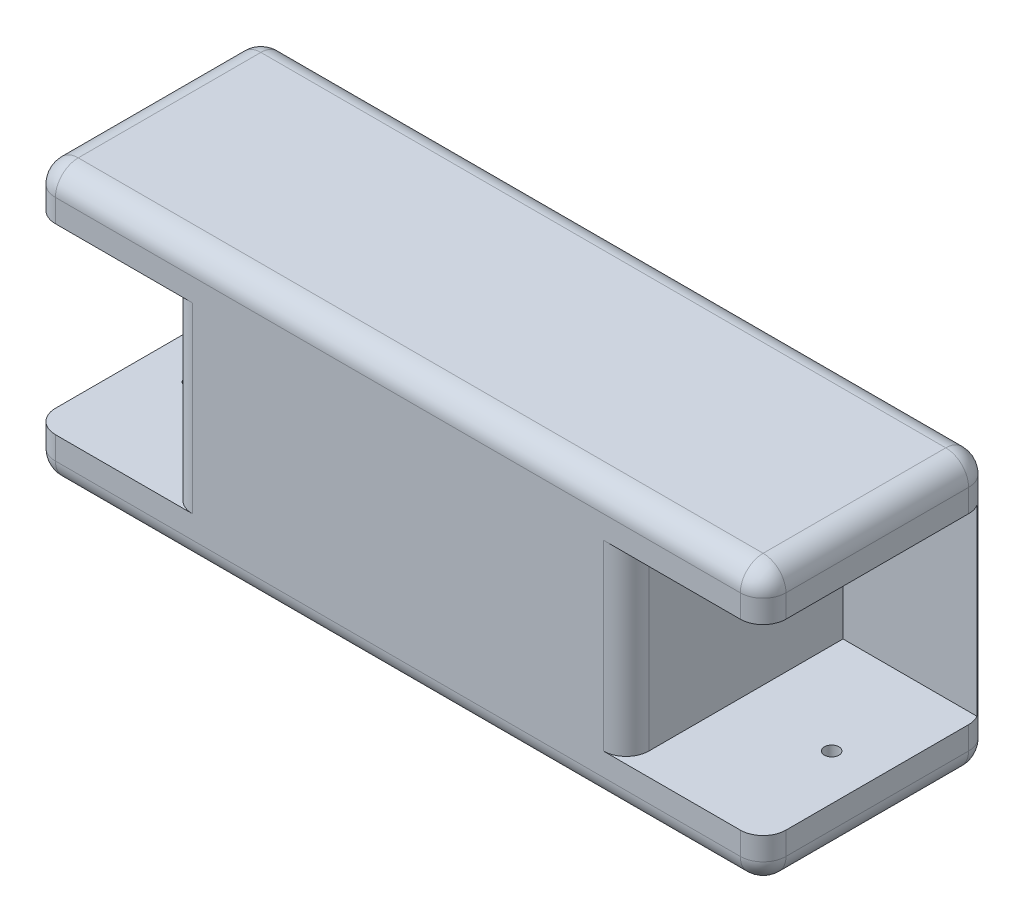
from build123d import *

# Parameters (mm, degrees)
SKETCH2_W           = 160
SKETCH2_H           = 60
BOSS_EXTRUDE1_DEPTH = 50
SKETCH4_W           = 30
SKETCH4_H           = 40
CUT_EXTRUDE1_DEPTH  = 99.994949366
SKETCH5_R           = 1.6
CUT_EXTRUDE2_DEPTH  = 3.2
CUT_EXTRUDE3_START  = -3.2
SKETCH6_R           = 1.6
CUT_EXTRUDE3_DEPTH  = 3.2
CUT_EXTRUDE5_START  = -6.8
SKETCH7_R           = 1.6
CUT_EXTRUDE5_DEPTH  = 3.2
CUT_EXTRUDE6_START  = -10
SKETCH8_R           = 1.6
CUT_EXTRUDE6_DEPTH  = 3.2
SKETCH9_W           = 2.5
SKETCH9_H           = 40
BOSS_EXTRUDE2_DEPTH = 30
SKETCH10_W          = 2.5
SKETCH10_H          = 40
BOSS_EXTRUDE3_DEPTH = 30
FILLET1_R           = 5


with BuildPart() as part:
    # Sketch2 → Boss-Extrude1 (new body)
    with BuildSketch(Plane.XY):
        Rectangle(SKETCH2_W, SKETCH2_H)
    extrude(amount=BOSS_EXTRUDE1_DEPTH)

    # Sketch4 → Cut-Extrude1 (cut, through all)
    with BuildSketch(Plane.XY.offset(50)):
        with Locations((65, 0)):
            Rectangle(SKETCH4_W, SKETCH4_H)
        with Locations((-65, 0)):
            Rectangle(SKETCH4_W, SKETCH4_H)
    extrude(amount=-CUT_EXTRUDE1_DEPTH, mode=Mode.SUBTRACT)

    # Sketch5 → Cut-Extrude2 (cut)
    with BuildSketch(Plane(origin=(0, 20, 0), x_dir=(-1, 0, 0), z_dir=(0, -1, 0))):
        with Locations(Location((70, -25, 0), (0, 0, 90))):
            Circle(SKETCH5_R)
    extrude(amount=-CUT_EXTRUDE2_DEPTH, mode=Mode.SUBTRACT)

    # Sketch6 → Cut-Extrude3 (cut)
    with BuildSketch(Plane(origin=(0, -20, 0), x_dir=(1, 0, 0), z_dir=(0, 1, 0)).offset(CUT_EXTRUDE3_START)):
        with Locations(Location((-70, -25, 0), (0, 0, 90))):
            Circle(SKETCH6_R)
    extrude(amount=CUT_EXTRUDE3_DEPTH, mode=Mode.SUBTRACT)

    # Sketch7 → Cut-Extrude5 (cut)
    with BuildSketch(Plane(origin=(0, 30, 0), x_dir=(1, 0, 0), z_dir=(0, 1, 0)).offset(CUT_EXTRUDE5_START)):
        with Locations(Location((70, -25, 0), (0, 0, 270))):
            Circle(SKETCH7_R)
    extrude(amount=-CUT_EXTRUDE5_DEPTH, mode=Mode.SUBTRACT)

    # Sketch8 → Cut-Extrude6 (cut)
    with BuildSketch(Plane.XZ.offset(30).offset(CUT_EXTRUDE6_START)):
        with Locations(Location((70, 25, 0), (0, 0, 90))):
            Circle(SKETCH8_R)
    extrude(amount=CUT_EXTRUDE6_DEPTH, mode=Mode.SUBTRACT)

    # Sketch9 → Boss-Extrude2 (add)
    with BuildSketch(Plane.ZY.offset(50)):
        with Locations((1.25, 0)):
            Rectangle(SKETCH9_W, SKETCH9_H)
    extrude(amount=BOSS_EXTRUDE2_DEPTH)

    # Sketch10 → Boss-Extrude3 (add)
    with BuildSketch(Plane(origin=(50, 0, 0), x_dir=(0, 0, -1), z_dir=(1, 0, 0))):
        with Locations((-1.25, 0)):
            Rectangle(SKETCH10_W, SKETCH10_H)
    extrude(amount=BOSS_EXTRUDE3_DEPTH)

    # Fillet1
    # the kernel refuses this fillet: 5 mm, written as the material it takes off along each edge
    with BuildSketch(Plane(origin=(-75, -25, 45), x_dir=(0, -1, 0), z_dir=(0, 0, 1))) as fillet1_piece_1_section:
        Polygon((0, 0), (FILLET1_R, 0), (FILLET1_R, -FILLET1_R), (0, -FILLET1_R), align=None)
    fillet1_piece_1 = extrude(amount=FILLET1_R, mode=Mode.PRIVATE)
    fillet1_piece_1 = fillet1_piece_1 - Plane(origin=(-75, -25, 45), x_dir=(0.7071067811865475, 0.7071067811865475, 0), z_dir=(0, 0, 1)) * Sphere(FILLET1_R, mode=Mode.PRIVATE)
    add(fillet1_piece_1, mode=Mode.SUBTRACT)
    with BuildSketch(Plane(origin=(-75, 25, 45), x_dir=(0, 0, 1), z_dir=(0, 1, 0))) as fillet1_piece_2_section:
        Polygon((0, 0), (FILLET1_R, 0), (FILLET1_R, -FILLET1_R), (0, -FILLET1_R), align=None)
    fillet1_piece_2 = extrude(amount=FILLET1_R, mode=Mode.PRIVATE)
    fillet1_piece_2 = fillet1_piece_2 - Plane(origin=(-75, 25, 45), x_dir=(0.7071067811865475, 0, -0.7071067811865475), z_dir=(0, 1, 0)) * Sphere(FILLET1_R, mode=Mode.PRIVATE)
    add(fillet1_piece_2, mode=Mode.SUBTRACT)
    with BuildSketch(Plane(origin=(75, 25, 45), x_dir=(0, 0, 1), z_dir=(0, 1, 0))) as fillet1_piece_3_section:
        Polygon((0, 0), (FILLET1_R, 0), (FILLET1_R, FILLET1_R), (0, FILLET1_R), align=None)
    fillet1_piece_3 = extrude(amount=FILLET1_R, mode=Mode.PRIVATE)
    fillet1_piece_3 = fillet1_piece_3 - Plane(origin=(75, 25, 45), x_dir=(-0.7071067811865475, 0, -0.7071067811865475), z_dir=(0, 1, 0)) * Sphere(FILLET1_R, mode=Mode.PRIVATE)
    add(fillet1_piece_3, mode=Mode.SUBTRACT)
    with BuildSketch(Plane(origin=(75, -25, 45), x_dir=(0, -1, 0), z_dir=(0, 0, 1))) as fillet1_piece_4_section:
        Polygon((0, 0), (FILLET1_R, 0), (FILLET1_R, FILLET1_R), (0, FILLET1_R), align=None)
    fillet1_piece_4 = extrude(amount=FILLET1_R, mode=Mode.PRIVATE)
    fillet1_piece_4 = fillet1_piece_4 - Plane(origin=(75, -25, 45), x_dir=(-0.7071067811865476, 0.7071067811865475, 0), z_dir=(0, 0, 1)) * Sphere(FILLET1_R, mode=Mode.PRIVATE)
    add(fillet1_piece_4, mode=Mode.SUBTRACT)
    with BuildSketch(Plane(origin=(75, -25, 5), x_dir=(0, 0, -1), z_dir=(0, -1, 0))) as fillet1_piece_5_section:
        Polygon((0, 0), (FILLET1_R, 0), (FILLET1_R, FILLET1_R), (0, FILLET1_R), align=None)
    fillet1_piece_5 = extrude(amount=FILLET1_R, mode=Mode.PRIVATE)
    fillet1_piece_5 = fillet1_piece_5 - Plane(origin=(75, -25, 5), x_dir=(-0.7071067811865475, 0, 0.7071067811865475), z_dir=(0, -1, 0)) * Sphere(FILLET1_R, mode=Mode.PRIVATE)
    add(fillet1_piece_5, mode=Mode.SUBTRACT)
    with BuildSketch(Plane(origin=(75, 25, 5), x_dir=(0, 0, -1), z_dir=(0, 1, 0))) as fillet1_piece_6_section:
        Polygon((0, 0), (FILLET1_R, 0), (FILLET1_R, -FILLET1_R), (0, -FILLET1_R), align=None)
    fillet1_piece_6 = extrude(amount=FILLET1_R, mode=Mode.PRIVATE)
    fillet1_piece_6 = fillet1_piece_6 - Plane(origin=(75, 25, 5), x_dir=(-0.7071067811865475, 0, 0.7071067811865475), z_dir=(0, 1, 0)) * Sphere(FILLET1_R, mode=Mode.PRIVATE)
    add(fillet1_piece_6, mode=Mode.SUBTRACT)
    with BuildSketch(Plane(origin=(-75, 25, 5), x_dir=(0, 0, -1), z_dir=(0, 1, 0))) as fillet1_piece_7_section:
        Polygon((0, 0), (FILLET1_R, 0), (FILLET1_R, FILLET1_R), (0, FILLET1_R), align=None)
    fillet1_piece_7 = extrude(amount=FILLET1_R, mode=Mode.PRIVATE)
    fillet1_piece_7 = fillet1_piece_7 - Plane(origin=(-75, 25, 5), x_dir=(0.7071067811865475, 0, 0.7071067811865475), z_dir=(0, 1, 0)) * Sphere(FILLET1_R, mode=Mode.PRIVATE)
    add(fillet1_piece_7, mode=Mode.SUBTRACT)
    with BuildSketch(Plane(origin=(-75, -25, 5), x_dir=(0, 0, -1), z_dir=(0, -1, 0))) as fillet1_piece_8_section:
        Polygon((0, 0), (FILLET1_R, 0), (FILLET1_R, -FILLET1_R), (0, -FILLET1_R), align=None)
    fillet1_piece_8 = extrude(amount=FILLET1_R, mode=Mode.PRIVATE)
    fillet1_piece_8 = fillet1_piece_8 - Plane(origin=(-75, -25, 5), x_dir=(0.7071067811865475, 0, 0.7071067811865475), z_dir=(0, -1, 0)) * Sphere(FILLET1_R, mode=Mode.PRIVATE)
    add(fillet1_piece_8, mode=Mode.SUBTRACT)
    with BuildSketch(Plane(origin=(-80, -25, 50), x_dir=(1, 0, 0), z_dir=(0, 1, 0)), Plane(origin=(-80, 7.5, 50), x_dir=(1, 0, 0), z_dir=(0, 1, 0)), Plane(origin=(80, 25, 50), x_dir=(-1, 0, 0), z_dir=(0, -1, 0)), Plane(origin=(80, -7.5, 50), x_dir=(-1, 0, 0), z_dir=(0, -1, 0))) as fillet1_piece_9:
        with BuildLine():
            CenterArc((FILLET1_R, FILLET1_R), FILLET1_R, 180, 90)
            Line((0, FILLET1_R), (0, 0))
            Line((0, 0), (FILLET1_R, 0))
        make_face()
    extrude(amount=17.5, mode=Mode.SUBTRACT)
    with BuildSketch(Plane(origin=(50, 20, 50), x_dir=(-1, 0, 0), z_dir=(0, -1, 0)), Plane(origin=(80, 30, 5), x_dir=(-1, 0, 0), z_dir=(0, 0, 1)), Plane(origin=(-80, -30, 5), x_dir=(1, 0, 0), z_dir=(0, 0, 1))) as fillet1_piece_10:
        with BuildLine():
            CenterArc((FILLET1_R, FILLET1_R), FILLET1_R, 180, 90)
            Line((0, FILLET1_R), (0, 0))
            Line((0, 0), (FILLET1_R, 0))
        make_face()
    extrude(amount=40, mode=Mode.SUBTRACT)
    with BuildSketch(Plane(origin=(80, -30, 5), x_dir=(-1, 0, 0), z_dir=(0, 0, 1)), Plane(origin=(-80, 30, 5), x_dir=(1, 0, 0), z_dir=(0, 0, 1)), Plane(origin=(-50, 20, 50), x_dir=(1, 0, 0), z_dir=(0, -1, 0))) as fillet1_piece_11:
        with BuildLine():
            CenterArc((FILLET1_R, -FILLET1_R), FILLET1_R, 90, 90)
            Line((0, -FILLET1_R), (0, 0))
            Line((0, 0), (FILLET1_R, 0))
        make_face()
    extrude(amount=40, mode=Mode.SUBTRACT)
    with BuildSketch(Plane(origin=(80, -25, 0), x_dir=(-1, 0, 0), z_dir=(0, 1, 0)), Plane(origin=(-80, 25, 0), x_dir=(1, 0, 0), z_dir=(0, -1, 0))) as fillet1_piece_12:
        with BuildLine():
            CenterArc((FILLET1_R, FILLET1_R), FILLET1_R, 180, 90)
            Line((0, FILLET1_R), (0, 0))
            Line((0, 0), (FILLET1_R, 0))
        make_face()
    extrude(amount=50, mode=Mode.SUBTRACT)
    with BuildSketch(Plane(origin=(-75, 30, 0), x_dir=(0, 0, 1), z_dir=(1, 0, 0)), Plane(origin=(75, -30, 0), x_dir=(0, 0, 1), z_dir=(-1, 0, 0)), Plane(origin=(75, -30, 50), x_dir=(0, 1, 0), z_dir=(-1, 0, 0))) as fillet1_piece_13:
        with BuildLine():
            CenterArc((FILLET1_R, FILLET1_R), FILLET1_R, 180, 90)
            Line((0, FILLET1_R), (0, 0))
            Line((0, 0), (FILLET1_R, 0))
        make_face()
    extrude(amount=150, mode=Mode.SUBTRACT)
    with BuildSketch(Plane(origin=(-75, 30, 50), x_dir=(0, 0, -1), z_dir=(1, 0, 0))) as fillet1_piece_14:
        with BuildLine():
            CenterArc((FILLET1_R, -FILLET1_R), FILLET1_R, 90, 90)
            Line((0, -FILLET1_R), (0, 0))
            Line((0, 0), (FILLET1_R, 0))
        make_face()
    extrude(amount=150, mode=Mode.SUBTRACT)


solid = part.part
